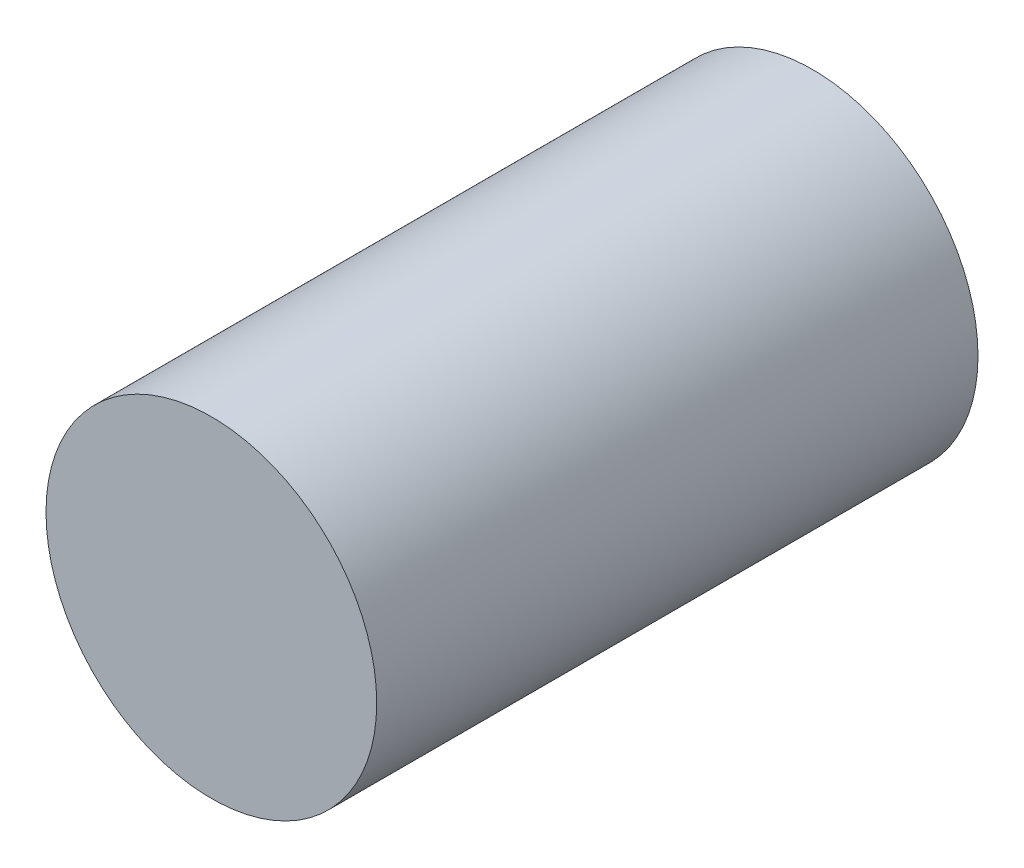
from build123d import *

# Parameters (mm, degrees)
FUSELAGE_START     = -254
FUSELAGE_OUTLINE_R = 139.7
FUSELAGE_DEPTH     = 508


# Read off the part's stored shape, not the designer's step: FuseLage
with BuildPart() as part:
    # FuseLage outline → FuseLage (new body)
    with BuildSketch(Plane.XY.offset(FUSELAGE_START)):
        Circle(FUSELAGE_OUTLINE_R)
    extrude(amount=FUSELAGE_DEPTH)


solid = part.part
